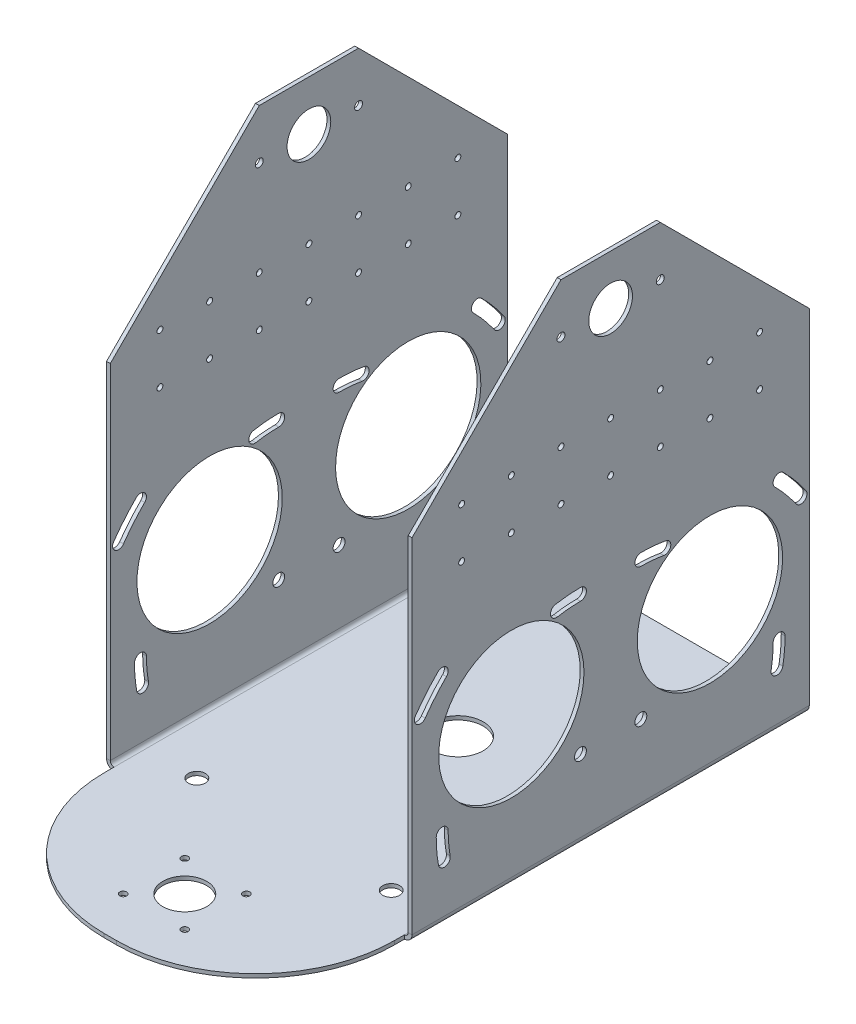
from build123d import *

# Parameters (mm, degrees)
BASE_FLANGE1_DEPTH  = 200
SKETCH6_R           = 36.576
SKETCH6_R_2         = 3
CUT_EXTRUDE1_DEPTH  = 356.179994092
SKETCH9_R           = 4.25
SKETCH9_R_2         = 12.7
CUT_EXTRUDE2_DEPTH  = 355.362546061
BREAK_CORNER1_START = -1.89738
BREAK_CORNER1_DEPTH = 153.79476
SKETCH11_R          = 11
SKETCH11_R_2        = 2
CUT_EXTRUDE3_DEPTH  = 356.179994092
SKETCH12_R          = 1.5
CUT_EXTRUDE4_DEPTH  = 356.179994092
TAB1_DEPTH          = 1.89738
SKETCH22_R          = 11.05
SKETCH22_R_2        = 1.75
CUT_EXTRUDE5_DEPTH  = 402.494475741


# Read off the part's stored shape, not the designer's step: Break-Corner1
# Sheet-metal steps are written as plain solids
with BuildPart() as part:
    # Sketch1 → Base-Flange1 (new body)
    with BuildSketch(Plane.XY):
        with BuildLine():
            Line((0, 250), (0, 1.89738))
            ThreePointArc((0, 1.89738), (0.555729736, 0.555729736), (1.89738, 0))
            Line((1.89738, 0), (148.10262, 0))
            ThreePointArc((148.10262, 0), (149.444270264, 0.555729736), (150, 1.89738))
            Line((150, 1.89738), (150, 250))
            Line((150, 250), (151.89738, 250))
            Line((151.89738, 250), (151.89738, 1.89738))
            ThreePointArc((151.89738, 1.89738), (150.785920529, -0.785920529), (148.10262, -1.89738))
            Line((148.10262, -1.89738), (1.89738, -1.89738))
            ThreePointArc((1.89738, -1.89738), (-0.785920529, -0.785920529), (-1.89738, 1.89738))
            Line((-1.89738, 1.89738), (-1.89738, 250))
            Line((-1.89738, 250), (0, 250))
        make_face()
    extrude(amount=BASE_FLANGE1_DEPTH)

    # Sketch6 → Cut-Extrude1 (cut, through all)
    with BuildSketch(Plane(origin=(151.89738, 0, 0), x_dir=(0, 0, -1), z_dir=(1, 0, 0))):
        with Locations((-150, 73.10262)):
            Circle(SKETCH6_R)
        with Locations((-115.2, 38.30262)):
            Circle(SKETCH6_R_2)
        with Locations(Location((-84.8, 38.30262, 0), (0, 0, 90))):
            Circle(SKETCH6_R_2)
        with Locations(Location((-50, 73.10262, 0), (0, 0, 90))):
            Circle(SKETCH6_R)
        with BuildLine():
            ThreePointArc((-187.8, 38.30262), (-187.523735081, 31.975113077), (-186.697042869, 25.695762301))
            ThreePointArc((-186.697042869, 25.695762301), (-183.221675077, 23.262283575), (-180.788196351, 26.737651367))
            ThreePointArc((-180.788196351, 26.737651367), (-181.546566893, 32.498047533), (-181.8, 38.30262))
            ThreePointArc((-181.8, 38.30262), (-184.8, 41.30262), (-187.8, 38.30262))
        make_face()
        with BuildLine():
            ThreePointArc((-115.2, 110.90262), (-121.527506923, 110.626355081), (-127.806857699, 109.799662869))
            ThreePointArc((-127.806857699, 109.799662869), (-130.240336425, 106.324295077), (-126.764968633, 103.890816351))
            ThreePointArc((-126.764968633, 103.890816351), (-121.004572467, 104.649186893), (-115.2, 104.90262))
            ThreePointArc((-115.2, 104.90262), (-112.2, 107.90262), (-115.2, 110.90262))
        make_face()
        with BuildLine():
            ThreePointArc((-186.921320344, 110.023940344), (-192.899324012, 103.500094121), (-198.285988908, 96.480055753))
            ThreePointArc((-198.285988908, 96.480055753), (-197.549262084, 92.301870311), (-193.371076642, 93.038597135))
            ThreePointArc((-193.371076642, 93.038597135), (-188.303057353, 99.643368463), (-182.678679656, 105.781299656))
            ThreePointArc((-182.678679656, 105.781299656), (-182.678679656, 110.023940344), (-186.921320344, 110.023940344))
        make_face()
        with BuildLine():
            ThreePointArc((-12.2, 38.30262), (-12.476264919, 31.975113077), (-13.302957131, 25.695762301))
            ThreePointArc((-13.302957131, 25.695762301), (-16.778324923, 23.262283575), (-19.211803649, 26.737651367))
            ThreePointArc((-19.211803649, 26.737651367), (-18.453433107, 32.498047533), (-18.2, 38.30262))
            ThreePointArc((-18.2, 38.30262), (-15.2, 41.30262), (-12.2, 38.30262))
        make_face()
        with BuildLine():
            ThreePointArc((-13.078679656, 110.023940344), (-7.100675988, 103.500094121), (-1.714011092, 96.480055753))
            ThreePointArc((-1.714011092, 96.480055753), (-2.450737916, 92.301870311), (-6.628923358, 93.038597135))
            ThreePointArc((-6.628923358, 93.038597135), (-11.696942647, 99.643368463), (-17.321320344, 105.781299656))
            ThreePointArc((-17.321320344, 105.781299656), (-17.321320344, 110.023940344), (-13.078679656, 110.023940344))
        make_face()
        with BuildLine():
            ThreePointArc((-84.8, 110.90262), (-78.472493077, 110.626355081), (-72.193142301, 109.799662869))
            ThreePointArc((-72.193142301, 109.799662869), (-69.759663575, 106.324295077), (-73.235031367, 103.890816351))
            ThreePointArc((-73.235031367, 103.890816351), (-78.995427533, 104.649186893), (-84.8, 104.90262))
            ThreePointArc((-84.8, 104.90262), (-87.8, 107.90262), (-84.8, 110.90262))
        make_face()
    extrude(amount=-CUT_EXTRUDE1_DEPTH, mode=Mode.SUBTRACT)

    # Sketch9 → Cut-Extrude2 (cut, through all)
    with BuildSketch(Plane(origin=(0, 0, 0), x_dir=(1, 0, 0), z_dir=(0, 1, 0))):
        with Locations(Location((31.12186195, -16, 0), (0, 0, 270))):
            Circle(SKETCH9_R)
        with Locations(Location((127.199853887, -16, 0), (0, 0, 270))):
            Circle(SKETCH9_R)
        with Locations(Location((75, -100, 0), (0, 0, 270))):
            Circle(SKETCH9_R_2)
        with Locations(Location((27.591437049, -184, 0), (0, 0, 270))):
            Circle(SKETCH9_R)
        with Locations(Location((125.434641437, -184, 0), (0, 0, 270))):
            Circle(SKETCH9_R)
    extrude(amount=-CUT_EXTRUDE2_DEPTH, mode=Mode.SUBTRACT)

    # Break-Corner1 outline → Break-Corner1 (cut)
    with BuildSketch(Plane.YZ.offset(BREAK_CORNER1_START)):
        Polygon((250, 200), (175, 200), (250, 125), align=None)
        Polygon((250, 0), (250, 75), (175, 0), align=None)
    extrude(amount=BREAK_CORNER1_DEPTH, mode=Mode.SUBTRACT)

    # Sketch11 → Cut-Extrude3 (cut, through all)
    with BuildSketch(Plane(origin=(151.89738, 0, 0), x_dir=(0, 0, -1), z_dir=(1, 0, 0))):
        with Locations((-100, 225)):
            Circle(SKETCH11_R)
        with Locations((-125, 225)):
            Circle(SKETCH11_R_2)
        with Locations((-75, 225)):
            Circle(SKETCH11_R_2)
    extrude(amount=-CUT_EXTRUDE3_DEPTH, mode=Mode.SUBTRACT)

    # Sketch12 → Cut-Extrude4 (cut, through all)
    with BuildSketch(Plane(origin=(151.89738, 0, 0), x_dir=(0, 0, -1), z_dir=(1, 0, 0))):
        with Locations((-175, 152.16932205)):
            Circle(SKETCH12_R)
        with Locations((-150, 152.16932205)):
            Circle(SKETCH12_R)
        with Locations((-125, 152.16932205)):
            Circle(SKETCH12_R)
        with Locations((-100, 152.16932205)):
            Circle(SKETCH12_R)
        with Locations((-75, 152.16932205)):
            Circle(SKETCH12_R)
        with Locations((-50, 152.16932205)):
            Circle(SKETCH12_R)
        with Locations((-25, 152.16932205)):
            Circle(SKETCH12_R)
        with Locations((-150, 177.16932205)):
            Circle(SKETCH12_R)
        with Locations((-125, 177.16932205)):
            Circle(SKETCH12_R)
        with Locations((-100, 177.16932205)):
            Circle(SKETCH12_R)
        with Locations((-75, 177.16932205)):
            Circle(SKETCH12_R)
        with Locations((-50, 177.16932205)):
            Circle(SKETCH12_R)
        with Locations((-25, 177.16932205)):
            Circle(SKETCH12_R)
        with Locations((-175, 177.16932205)):
            Circle(SKETCH12_R)
    extrude(amount=-CUT_EXTRUDE4_DEPTH, mode=Mode.SUBTRACT)

    # Sketch19 → Tab1 (add)
    with BuildSketch(Plane(origin=(0, 0, 0), x_dir=(1, 0, 0), z_dir=(0, 1, 0))):
        with BuildLine():
            Line((1.89738, -200), (148.10262, -200))
            Line((148.10262, -200), (148.10262, -205))
            ThreePointArc((148.10262, -205), (127.600094683, -254.497474683), (78.10262, -275))
            Line((78.10262, -275), (71.89738, -275))
            ThreePointArc((71.89738, -275), (22.399905317, -254.497474683), (1.89738, -205))
            Line((1.89738, -205), (1.89738, -200))
        make_face()
    extrude(amount=-TAB1_DEPTH)

    # Sketch22 → Cut-Extrude5 (cut, through all)
    with BuildSketch(Plane(origin=(0, 0, 0), x_dir=(1, 0, 0), z_dir=(0, 1, 0))):
        with Locations(Location((75, -237.5, 0), (0, 0, 270))):
            Circle(SKETCH22_R)
        with Locations(Location((59.5, -222, 0), (0, 0, 270))):
            Circle(SKETCH22_R_2)
        with Locations(Location((90.5, -222, 0), (0, 0, 270))):
            Circle(SKETCH22_R_2)
        with Locations(Location((90.5, -253, 0), (0, 0, 270))):
            Circle(SKETCH22_R_2)
        with Locations(Location((59.5, -253, 0), (0, 0, 270))):
            Circle(SKETCH22_R_2)
    extrude(amount=-CUT_EXTRUDE5_DEPTH, mode=Mode.SUBTRACT)


solid = part.part
